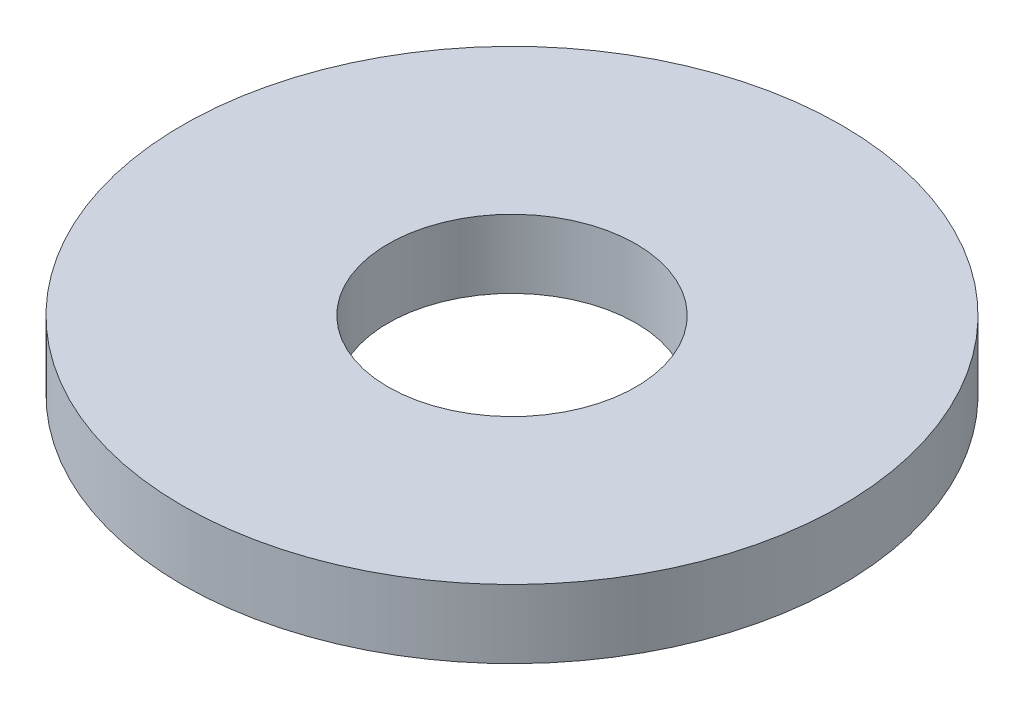
from build123d import *

# Parameters (mm, degrees)
SKETCH1_R           = 4.7625
BOSS_EXTRUDE1_DEPTH = 0.9906
SKETCH5_R           = 1.7907
CUT_EXTRUDE1_DEPTH  = 7.807650172


with BuildPart() as part:
    # Sketch1 → Boss-Extrude1 (new body)
    with BuildSketch(Plane(origin=(0, 0, 0), x_dir=(1, 0, 0), z_dir=(0, 1, 0))):
        Circle(SKETCH1_R)
    extrude(amount=BOSS_EXTRUDE1_DEPTH)

    # Sketch5 → Cut-Extrude1 (cut, through all)
    with BuildSketch(Plane(origin=(0, 0.9906, 0), x_dir=(-1, 0, 0), z_dir=(0, 1, 0))):
        Circle(SKETCH5_R)
    extrude(amount=-CUT_EXTRUDE1_DEPTH, mode=Mode.SUBTRACT)


solid = part.part
